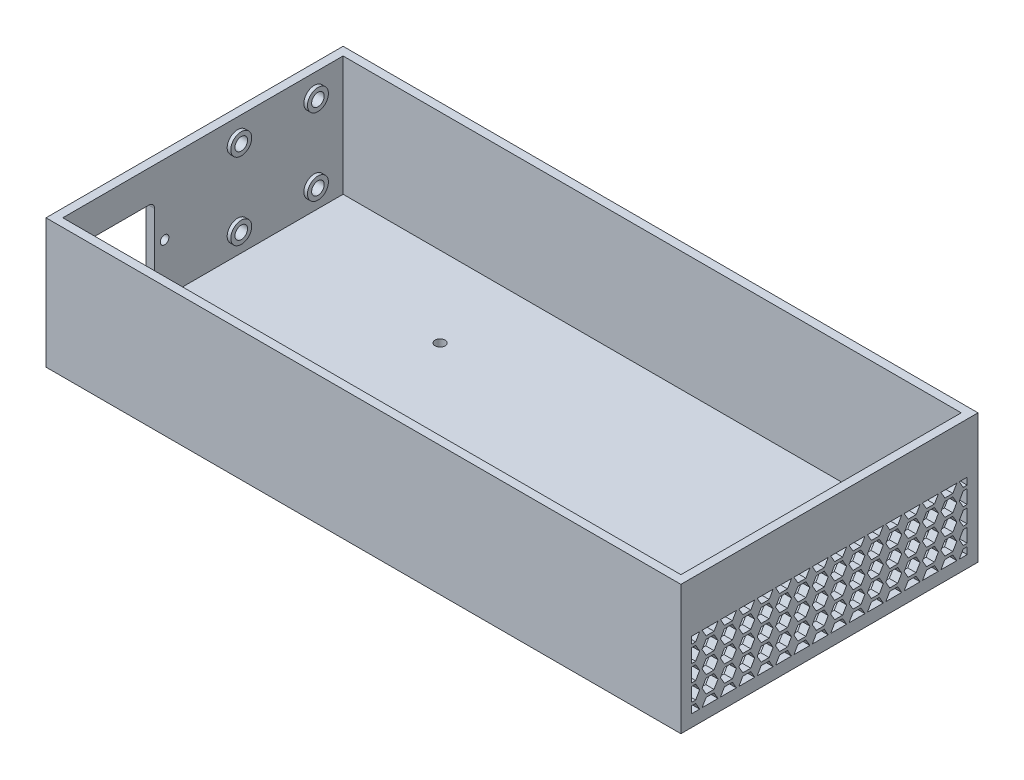
from build123d import *
from build123d.topology import SkipClean

# Parameters (mm, degrees)
BOSS_EXTRUDE1_DEPTH = 4
BOSS_EXTRUDE2_DEPTH = 50
SKETCH2_R           = 2.1
CUT_EXTRUDE1_DEPTH  = 255.873498034
SKETCH3_R           = 7.5
CUT_EXTRUDE2_DEPTH  = 1
CUT_EXTRUDE3_REACH  = 296.967
SKETCH5_R           = 1.8
CUT_EXTRUDE5_DEPTH  = 10
SKETCH8_R           = 2.625
CUT_EXTRUDE6_DEPTH  = 10
SKETCH10_R          = 4.375
SKETCH10_R_2        = 2.625
BOSS_EXTRUDE3_DEPTH = 1.5


with BuildPart() as part:
    # Sketch1 → Boss-Extrude1 (new body)
    with BuildSketch(Plane(origin=(0, 0, 0), x_dir=(1, 0, 0), z_dir=(0, 1, 0))):
        Polygon((0, -119.5), (-45.5, -119.5), (-45.5, 4.5), (0, 4.5), (219.5, 4.5), (219.5, -119.5), align=None)
    extrude(amount=-BOSS_EXTRUDE1_DEPTH)

    # Sketch1<3> → Boss-Extrude2 (add)
    with BuildSketch(Plane(origin=(0, 0, 0), x_dir=(1, 0, 0), z_dir=(0, 1, 0))):
        Polygon((-45.5, -119.5), (0, -119.5), (219.5, -119.5), (219.5, 4.5), (0, 4.5), (-45.5, 4.5), align=None)
        Polygon((-42, 1), (0, 1), (216, 1), (216, -116), (0, -116), (-42, -116), align=None, mode=Mode.SUBTRACT)
    extrude(amount=BOSS_EXTRUDE2_DEPTH)

    # Sketch2 → Cut-Extrude1 (cut, through all)
    with BuildSketch(Plane(origin=(0, 0, 0), x_dir=(1, 0, 0), z_dir=(0, 1, 0))):
        with Locations((32, -32.5)):
            Circle(SKETCH2_R)
        with Locations((182, -32.5)):
            Circle(SKETCH2_R)
        with Locations((182, -82.5)):
            Circle(SKETCH2_R)
        with Locations((32, -82.5)):
            Circle(SKETCH2_R)
    extrude(amount=-CUT_EXTRUDE1_DEPTH, mode=Mode.SUBTRACT)

    # Sketch3 → Cut-Extrude2 (cut)
    with BuildSketch(Plane.XZ.offset(4)):
        with Locations((-33.5, 107.5)):
            Circle(SKETCH3_R)
        with Locations((207.5, 107.5)):
            Circle(SKETCH3_R)
        with Locations((207.5, 7.5)):
            Circle(SKETCH3_R)
        with Locations((-33.5, 7.5)):
            Circle(SKETCH3_R)
    extrude(amount=-CUT_EXTRUDE2_DEPTH, mode=Mode.SUBTRACT)

    # Sketch5 → Cut-Extrude3 (cut, up to next)
    with BuildSketch(Plane.ZY.offset(45.5), mode=Mode.PRIVATE) as cut_extrude3_sk1:
        with Locations((73.5, 20.805)):
            Circle(SKETCH5_R)
    cut_extrude3_tool1 = extrude(cut_extrude3_sk1.sketch, amount=-CUT_EXTRUDE3_REACH, mode=Mode.PRIVATE) & part.part
    # Sketch5 → Cut-Extrude3 (cut, up to next)
    with BuildSketch(Plane.ZY.offset(45.5), mode=Mode.PRIVATE) as cut_extrude3_sk2:
        with Locations((109.5, 20.805)):
            Circle(SKETCH5_R)
    cut_extrude3_tool2 = extrude(cut_extrude3_sk2.sketch, amount=-CUT_EXTRUDE3_REACH, mode=Mode.PRIVATE) & part.part
    # Sketch5 → Cut-Extrude3 (cut, up to next)
    with BuildSketch(Plane.ZY.offset(45.5), mode=Mode.PRIVATE) as cut_extrude3_sk3:
        with BuildLine():
            Line((80.105, 36.61), (102.895, 36.61))
            ThreePointArc((102.895, 36.61), (104.599127343, 35.904127343), (105.305, 34.2))
            Line((105.305, 34.2), (105.305, 7.41))
            ThreePointArc((105.305, 7.41), (104.599127343, 5.705872657), (102.895, 5))
            Line((102.895, 5), (80.105, 5))
            ThreePointArc((80.105, 5), (78.400872657, 5.705872657), (77.695, 7.41))
            Line((77.695, 7.41), (77.695, 34.2))
            ThreePointArc((77.695, 34.2), (78.400872657, 35.904127343), (80.105, 36.61))
        make_face()
    cut_extrude3_tool3 = extrude(cut_extrude3_sk3.sketch, amount=-CUT_EXTRUDE3_REACH, mode=Mode.PRIVATE) & part.part
    add(cut_extrude3_tool1.solids().sort_by_distance((-45.5, 20.805, 73.5))[0], mode=Mode.SUBTRACT)
    add(cut_extrude3_tool2.solids().sort_by_distance((-45.5, 20.805, 109.5))[0], mode=Mode.SUBTRACT)
    add(cut_extrude3_tool3.solids().sort_by_distance((-45.5, 20.805, 91.5))[0], mode=Mode.SUBTRACT)

    # Sketch6 → Cut-Extrude5 (cut)
    with BuildSketch(Plane(origin=(219.5, 0, 0), x_dir=(0, 0, -1), z_dir=(1, 0, 0))):
        Polygon((-111.680235952, 29), (-115, 29), (-115, 26.125), (-113.340117976, 26.125), align=None)
        Polygon((-104.013569285, 29), (-110.653097381, 29), (-108.993215357, 26.125), (-105.673451309, 26.125), align=None)
        Polygon((-113.340117976, 24.875), (-115, 24.875), (-115, 19.125), (-113.340117976, 19.125), (-111.680235952, 22), align=None)
        Polygon((-96.346902619, 29), (-102.986430715, 29), (-101.326548691, 26.125), (-98.006784643, 26.125), align=None)
        Polygon((-113.340117976, 17.875), (-115, 17.875), (-115, 12.125), (-113.340117976, 12.125), (-111.680235952, 15), align=None)
        Polygon((-88.680235952, 29), (-95.319764048, 29), (-93.659882024, 26.125), (-90.340117976, 26.125), align=None)
        Polygon((-113.340117976, 10.875), (-115, 10.875), (-115, 5.125), (-113.340117976, 5.125), (-111.680235952, 8), align=None)
        Polygon((-81.013569285, 29), (-87.653097381, 29), (-85.993215357, 26.125), (-82.673451309, 26.125), align=None)
        Polygon((-113.340117976, 3.875), (-115, 3.875), (-115, 1), (-111.680235952, 1), align=None)
        Polygon((-73.346902619, 29), (-79.986430715, 29), (-78.326548691, 26.125), (-75.006784643, 26.125), align=None)
        Polygon((-108.993215357, 3.875), (-110.653097381, 1), (-104.013569285, 1), (-105.673451309, 3.875), align=None)
        Polygon((-65.680235952, 29), (-72.319764048, 29), (-70.659882024, 26.125), (-67.340117976, 26.125), align=None)
        Polygon((-101.326548691, 3.875), (-102.986430715, 1), (-96.346902619, 1), (-98.006784643, 3.875), align=None)
        Polygon((-58.013569285, 29), (-64.653097381, 29), (-62.993215357, 26.125), (-59.673451309, 26.125), align=None)
        Polygon((-93.659882024, 3.875), (-95.319764048, 1), (-88.680235952, 1), (-90.340117976, 3.875), align=None)
        Polygon((-50.346902619, 29), (-56.986430715, 29), (-55.326548691, 26.125), (-52.006784643, 26.125), align=None)
        Polygon((-85.993215357, 3.875), (-87.653097381, 1), (-81.013569285, 1), (-82.673451309, 3.875), align=None)
        Polygon((-42.680235952, 29), (-49.319764048, 29), (-47.659882024, 26.125), (-44.340117976, 26.125), align=None)
        Polygon((-78.326548691, 3.875), (-79.986430715, 1), (-73.346902619, 1), (-75.006784643, 3.875), align=None)
        Polygon((-35.013569285, 29), (-41.653097381, 29), (-39.993215357, 26.125), (-36.673451309, 26.125), align=None)
        Polygon((-70.659882024, 3.875), (-72.319764048, 1), (-65.680235952, 1), (-67.340117976, 3.875), align=None)
        Polygon((-27.346902619, 29), (-33.986430715, 29), (-32.326548691, 26.125), (-29.006784643, 26.125), align=None)
        Polygon((-62.993215357, 3.875), (-64.653097381, 1), (-58.013569285, 1), (-59.673451309, 3.875), align=None)
        Polygon((-19.680235952, 29), (-26.319764048, 29), (-24.659882024, 26.125), (-21.340117976, 26.125), align=None)
        Polygon((-55.326548691, 3.875), (-56.986430715, 1), (-50.346902619, 1), (-52.006784643, 3.875), align=None)
        Polygon((-12.013569285, 29), (-18.653097381, 29), (-16.993215357, 26.125), (-13.673451309, 26.125), align=None)
        Polygon((-47.659882024, 3.875), (-49.319764048, 1), (-42.680235952, 1), (-44.340117976, 3.875), align=None)
        Polygon((-4.346902619, 29), (-10.986430715, 29), (-9.326548691, 26.125), (-6.006784643, 26.125), align=None)
        Polygon((-39.993215357, 3.875), (-41.653097381, 1), (-35.013569285, 1), (-36.673451309, 3.875), align=None)
        Polygon((0, 29), (-3.319764048, 29), (-1.659882024, 26.125), (0, 26.125), align=None)
        Polygon((-32.326548691, 3.875), (-33.986430715, 1), (-27.346902619, 1), (-29.006784643, 3.875), align=None)
        Polygon((0, 19.125), (0, 24.875), (-1.659882024, 24.875), (-3.319764048, 22), (-1.659882024, 19.125), align=None)
        Polygon((-24.659882024, 3.875), (-26.319764048, 1), (-19.680235952, 1), (-21.340117976, 3.875), align=None)
        Polygon((0, 12.125), (0, 17.875), (-1.659882024, 17.875), (-3.319764048, 15), (-1.659882024, 12.125), align=None)
        Polygon((-16.993215357, 3.875), (-18.653097381, 1), (-12.013569285, 1), (-13.673451309, 3.875), align=None)
        Polygon((0, 5.125), (0, 10.875), (-1.659882024, 10.875), (-3.319764048, 8), (-1.659882024, 5.125), align=None)
        Polygon((-9.326548691, 3.875), (-10.986430715, 1), (-4.346902619, 1), (-6.006784643, 3.875), align=None)
        Polygon((0, 1), (0, 3.875), (-1.659882024, 3.875), (-3.319764048, 1), align=None)
        Polygon((-105.673451309, 19.125), (-104.013569285, 22), (-105.673451309, 24.875), (-108.993215357, 24.875), (-110.653097381, 22), (-108.993215357, 19.125), align=None)
        Polygon((-98.006784643, 19.125), (-96.346902619, 22), (-98.006784643, 24.875), (-101.326548691, 24.875), (-102.986430715, 22), (-101.326548691, 19.125), align=None)
        Polygon((-90.340117976, 19.125), (-88.680235952, 22), (-90.340117976, 24.875), (-93.659882024, 24.875), (-95.319764048, 22), (-93.659882024, 19.125), align=None)
        Polygon((-82.673451309, 19.125), (-81.013569285, 22), (-82.673451309, 24.875), (-85.993215357, 24.875), (-87.653097381, 22), (-85.993215357, 19.125), align=None)
        Polygon((-75.006784643, 19.125), (-73.346902619, 22), (-75.006784643, 24.875), (-78.326548691, 24.875), (-79.986430715, 22), (-78.326548691, 19.125), align=None)
        Polygon((-67.340117976, 19.125), (-65.680235952, 22), (-67.340117976, 24.875), (-70.659882024, 24.875), (-72.319764048, 22), (-70.659882024, 19.125), align=None)
        Polygon((-59.673451309, 19.125), (-58.013569285, 22), (-59.673451309, 24.875), (-62.993215357, 24.875), (-64.653097381, 22), (-62.993215357, 19.125), align=None)
        Polygon((-52.006784643, 19.125), (-50.346902619, 22), (-52.006784643, 24.875), (-55.326548691, 24.875), (-56.986430715, 22), (-55.326548691, 19.125), align=None)
        Polygon((-44.340117976, 19.125), (-42.680235952, 22), (-44.340117976, 24.875), (-47.659882024, 24.875), (-49.319764048, 22), (-47.659882024, 19.125), align=None)
        Polygon((-36.673451309, 19.125), (-35.013569285, 22), (-36.673451309, 24.875), (-39.993215357, 24.875), (-41.653097381, 22), (-39.993215357, 19.125), align=None)
        Polygon((-29.006784643, 19.125), (-27.346902619, 22), (-29.006784643, 24.875), (-32.326548691, 24.875), (-33.986430715, 22), (-32.326548691, 19.125), align=None)
        Polygon((-21.340117976, 19.125), (-19.680235952, 22), (-21.340117976, 24.875), (-24.659882024, 24.875), (-26.319764048, 22), (-24.659882024, 19.125), align=None)
        Polygon((-13.673451309, 19.125), (-12.013569285, 22), (-13.673451309, 24.875), (-16.993215357, 24.875), (-18.653097381, 22), (-16.993215357, 19.125), align=None)
        Polygon((-6.006784643, 19.125), (-4.346902619, 22), (-6.006784643, 24.875), (-9.326548691, 24.875), (-10.986430715, 22), (-9.326548691, 19.125), align=None)
        Polygon((-105.673451309, 12.125), (-104.013569285, 15), (-105.673451309, 17.875), (-108.993215357, 17.875), (-110.653097381, 15), (-108.993215357, 12.125), align=None)
        Polygon((-98.006784643, 12.125), (-96.346902619, 15), (-98.006784643, 17.875), (-101.326548691, 17.875), (-102.986430715, 15), (-101.326548691, 12.125), align=None)
        Polygon((-90.340117976, 12.125), (-88.680235952, 15), (-90.340117976, 17.875), (-93.659882024, 17.875), (-95.319764048, 15), (-93.659882024, 12.125), align=None)
        Polygon((-82.673451309, 12.125), (-81.013569285, 15), (-82.673451309, 17.875), (-85.993215357, 17.875), (-87.653097381, 15), (-85.993215357, 12.125), align=None)
        Polygon((-75.006784643, 12.125), (-73.346902619, 15), (-75.006784643, 17.875), (-78.326548691, 17.875), (-79.986430715, 15), (-78.326548691, 12.125), align=None)
        Polygon((-67.340117976, 12.125), (-65.680235952, 15), (-67.340117976, 17.875), (-70.659882024, 17.875), (-72.319764048, 15), (-70.659882024, 12.125), align=None)
        Polygon((-59.673451309, 12.125), (-58.013569285, 15), (-59.673451309, 17.875), (-62.993215357, 17.875), (-64.653097381, 15), (-62.993215357, 12.125), align=None)
        Polygon((-52.006784643, 12.125), (-50.346902619, 15), (-52.006784643, 17.875), (-55.326548691, 17.875), (-56.986430715, 15), (-55.326548691, 12.125), align=None)
        Polygon((-44.340117976, 12.125), (-42.680235952, 15), (-44.340117976, 17.875), (-47.659882024, 17.875), (-49.319764048, 15), (-47.659882024, 12.125), align=None)
        Polygon((-36.673451309, 12.125), (-35.013569285, 15), (-36.673451309, 17.875), (-39.993215357, 17.875), (-41.653097381, 15), (-39.993215357, 12.125), align=None)
        Polygon((-29.006784643, 12.125), (-27.346902619, 15), (-29.006784643, 17.875), (-32.326548691, 17.875), (-33.986430715, 15), (-32.326548691, 12.125), align=None)
        Polygon((-21.340117976, 12.125), (-19.680235952, 15), (-21.340117976, 17.875), (-24.659882024, 17.875), (-26.319764048, 15), (-24.659882024, 12.125), align=None)
        Polygon((-13.673451309, 12.125), (-12.013569285, 15), (-13.673451309, 17.875), (-16.993215357, 17.875), (-18.653097381, 15), (-16.993215357, 12.125), align=None)
        Polygon((-6.006784643, 12.125), (-4.346902619, 15), (-6.006784643, 17.875), (-9.326548691, 17.875), (-10.986430715, 15), (-9.326548691, 12.125), align=None)
        Polygon((-105.673451309, 5.125), (-104.013569285, 8), (-105.673451309, 10.875), (-108.993215357, 10.875), (-110.653097381, 8), (-108.993215357, 5.125), align=None)
        Polygon((-98.006784643, 5.125), (-96.346902619, 8), (-98.006784643, 10.875), (-101.326548691, 10.875), (-102.986430715, 8), (-101.326548691, 5.125), align=None)
        Polygon((-90.340117976, 5.125), (-88.680235952, 8), (-90.340117976, 10.875), (-93.659882024, 10.875), (-95.319764048, 8), (-93.659882024, 5.125), align=None)
        Polygon((-82.673451309, 5.125), (-81.013569285, 8), (-82.673451309, 10.875), (-85.993215357, 10.875), (-87.653097381, 8), (-85.993215357, 5.125), align=None)
        Polygon((-75.006784643, 5.125), (-73.346902619, 8), (-75.006784643, 10.875), (-78.326548691, 10.875), (-79.986430715, 8), (-78.326548691, 5.125), align=None)
        Polygon((-67.340117976, 5.125), (-65.680235952, 8), (-67.340117976, 10.875), (-70.659882024, 10.875), (-72.319764048, 8), (-70.659882024, 5.125), align=None)
        Polygon((-59.673451309, 5.125), (-58.013569285, 8), (-59.673451309, 10.875), (-62.993215357, 10.875), (-64.653097381, 8), (-62.993215357, 5.125), align=None)
        Polygon((-52.006784643, 5.125), (-50.346902619, 8), (-52.006784643, 10.875), (-55.326548691, 10.875), (-56.986430715, 8), (-55.326548691, 5.125), align=None)
        Polygon((-44.340117976, 5.125), (-42.680235952, 8), (-44.340117976, 10.875), (-47.659882024, 10.875), (-49.319764048, 8), (-47.659882024, 5.125), align=None)
        Polygon((-36.673451309, 5.125), (-35.013569285, 8), (-36.673451309, 10.875), (-39.993215357, 10.875), (-41.653097381, 8), (-39.993215357, 5.125), align=None)
        Polygon((-29.006784643, 5.125), (-27.346902619, 8), (-29.006784643, 10.875), (-32.326548691, 10.875), (-33.986430715, 8), (-32.326548691, 5.125), align=None)
        Polygon((-21.340117976, 5.125), (-19.680235952, 8), (-21.340117976, 10.875), (-24.659882024, 10.875), (-26.319764048, 8), (-24.659882024, 5.125), align=None)
        Polygon((-13.673451309, 5.125), (-12.013569285, 8), (-13.673451309, 10.875), (-16.993215357, 10.875), (-18.653097381, 8), (-16.993215357, 5.125), align=None)
        Polygon((-6.006784643, 5.125), (-4.346902619, 8), (-6.006784643, 10.875), (-9.326548691, 10.875), (-10.986430715, 8), (-9.326548691, 5.125), align=None)
    extrude(amount=-CUT_EXTRUDE5_DEPTH, mode=Mode.SUBTRACT)

    # Sketch8 → Cut-Extrude6 (cut)
    with BuildSketch(Plane.ZY.offset(45.5)):
        with Locations((11, 41)):
            Circle(SKETCH8_R)
        with Locations((43, 41)):
            Circle(SKETCH8_R)
        with Locations((43, 9)):
            Circle(SKETCH8_R)
        with Locations((11, 9)):
            Circle(SKETCH8_R)
    extrude(amount=-CUT_EXTRUDE6_DEPTH, mode=Mode.SUBTRACT)

    # Sketch10 → Boss-Extrude3 (add)
    # profile 1 of 4: a face of its own
    with SkipClean():  # the faces are left unmerged after this step: merging them gives an invalid solid
        with BuildSketch(Plane(origin=(-42, 0, 0), x_dir=(0, 0, -1), z_dir=(1, 0, 0))):
            with Locations((-43, 41)):
                Circle(SKETCH10_R)
            with Locations((-43, 41)):
                Circle(SKETCH10_R_2, mode=Mode.SUBTRACT)
        # profile 2 of 4: a face of its own
        with BuildSketch(Plane(origin=(-42, 0, 0), x_dir=(0, 0, -1), z_dir=(1, 0, 0))):
            with Locations((-11, 41)):
                Circle(SKETCH10_R)
            with Locations((-11, 41)):
                Circle(SKETCH10_R_2, mode=Mode.SUBTRACT)
        # profile 3 of 4: a face of its own
        with BuildSketch(Plane(origin=(-42, 0, 0), x_dir=(0, 0, -1), z_dir=(1, 0, 0))):
            with Locations((-11, 9)):
                Circle(SKETCH10_R)
            with Locations((-11, 9)):
                Circle(SKETCH10_R_2, mode=Mode.SUBTRACT)
        # profile 4 of 4: a face of its own
        with BuildSketch(Plane(origin=(-42, 0, 0), x_dir=(0, 0, -1), z_dir=(1, 0, 0))):
            with Locations((-43, 9)):
                Circle(SKETCH10_R)
            with Locations((-43, 9)):
                Circle(SKETCH10_R_2, mode=Mode.SUBTRACT)
        extrude(amount=BOSS_EXTRUDE3_DEPTH)


solid = part.part
